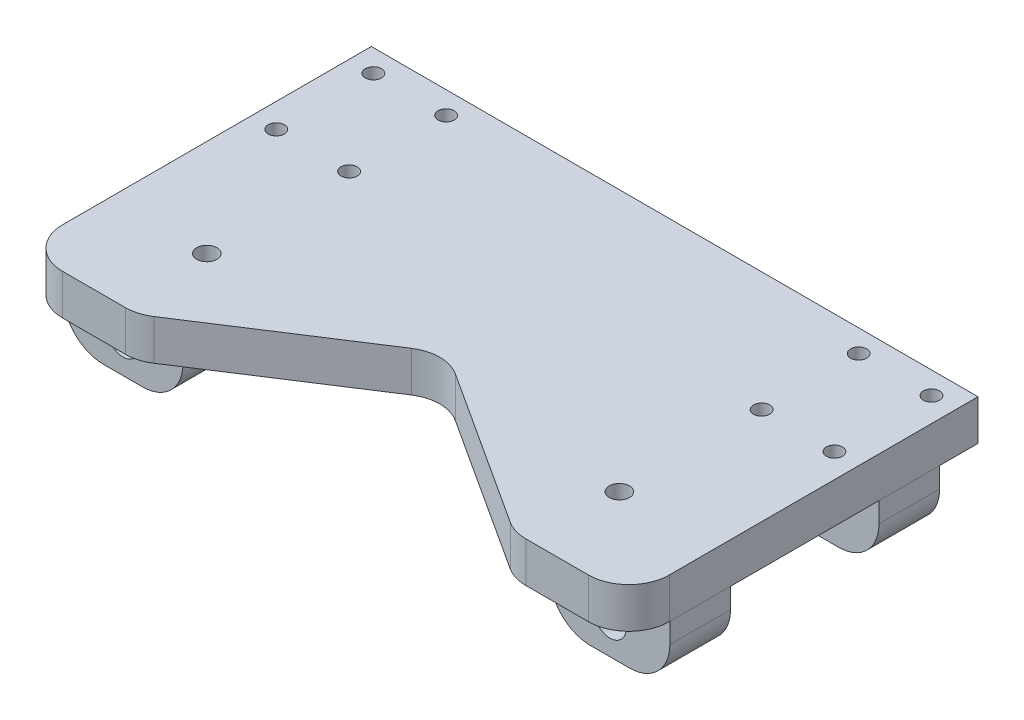
from build123d import *

# Parameters (mm, degrees)
SKETCH3_R               = 2
SKETCH3_R_2             = 2.5
BOSS_EXTRUDE3_DEPTH     = 10
SKETCH4_W               = 29.621982307
SKETCH4_H               = 15
SKETCH4_W_2             = 29.629902686
BOSS_EXTRUDE4_DEPTH     = 15
FILLET1_R               = 10
CUT_EXTRUDE1_DEPTH      = 57
CUT_EXTRUDE1_DEPTH_BACK = 15
SKETCH5_R               = 4
FILLET3_R               = 10


with BuildPart() as part:
    # Sketch3 → Boss-Extrude3 (new body)
    with BuildSketch(Plane(origin=(0, 0, 0), x_dir=(1, 0, 0), z_dir=(0, 1, 0))):
        with BuildLine():
            Line((-74.553080605, -18.028525235), (-74.553080605, 16.971474765))
            Line((-74.553080605, 16.971474765), (75.446919395, 16.971474765))
            Line((75.446919395, 16.971474765), (75.446919395, -18.028525235))
            Line((75.446919395, -18.028525235), (75.446919395, -59.351917417))
            ThreePointArc((75.446919395, -59.351917417), (72.517987207, -66.422985229), (65.446919395, -69.351917417))
            Line((65.446919395, -69.351917417), (49.960719272, -69.351917417))
            ThreePointArc((49.960719272, -69.351917417), (47.125982353, -68.941717551), (44.523807175, -67.744770737))
            Line((44.523807175, -67.744770737), (5.883831491, -42.713694512))
            ThreePointArc((5.883831491, -42.713694512), (0.446919395, -41.106547832), (-4.989992702, -42.713694512))
            Line((-4.989992702, -42.713694512), (-43.629968386, -67.744770737))
            ThreePointArc((-43.629968386, -67.744770737), (-46.232143563, -68.941717551), (-49.066880482, -69.351917417))
            Line((-49.066880482, -69.351917417), (-64.553080605, -69.351917417))
            ThreePointArc((-64.553080605, -69.351917417), (-71.624148417, -66.422985229), (-74.553080605, -59.351917417))
            Line((-74.553080605, -59.351917417), (-74.553080605, -18.028525235))
        make_face()
        with Locations((-68.553080605, 11.471474765)):
            Circle(SKETCH3_R, mode=Mode.SUBTRACT)
        with Locations((-50.553080605, 11.471474765)):
            Circle(SKETCH3_R, mode=Mode.SUBTRACT)
        with Locations((-68.553080605, -12.528525235)):
            Circle(SKETCH3_R, mode=Mode.SUBTRACT)
        with Locations((-50.553080605, -12.528525235)):
            Circle(SKETCH3_R, mode=Mode.SUBTRACT)
        with Locations((51.446919395, -12.528525235)):
            Circle(SKETCH3_R, mode=Mode.SUBTRACT)
        with Locations((69.446919395, -12.528525235)):
            Circle(SKETCH3_R, mode=Mode.SUBTRACT)
        with Locations((69.446919395, 11.471474765)):
            Circle(SKETCH3_R, mode=Mode.SUBTRACT)
        with Locations((51.446919395, 11.471474765)):
            Circle(SKETCH3_R, mode=Mode.SUBTRACT)
        with Locations((-50.553080605, -47.693315976)):
            Circle(SKETCH3_R_2, mode=Mode.SUBTRACT)
        with Locations((51.446919395, -47.693315976)):
            Circle(SKETCH3_R_2, mode=Mode.SUBTRACT)
    extrude(amount=BOSS_EXTRUDE3_DEPTH)

    # Sketch4 → Boss-Extrude4 (add)
    with BuildSketch(Plane.XZ):
        with Locations((-59.742089452, 0)):
            Rectangle(SKETCH4_W, SKETCH4_H)
        with Locations((60.624047673, 0)):
            Rectangle(SKETCH4_W_2, SKETCH4_H)
        with Locations((60.624047673, 51.713197214)):
            Rectangle(SKETCH4_W_2, SKETCH4_H)
        with Locations((-59.742089452, 51.713197214)):
            Rectangle(SKETCH4_W, SKETCH4_H)
    extrude(amount=BOSS_EXTRUDE4_DEPTH)

    # Fillet1
    fillet1_edges = [part.edges().sort_by_distance(p)[0] for p in [
        (75.438999016, -15, 0),
        (45.80909633, -15, 0),
        (-44.931098298, -15, 0),
        (-74.553080605, -15, 0),
    ]]
    fillet(fillet1_edges, radius=FILLET1_R)

    # Sketch5 → Cut-Extrude1 (cut, two sides: drawn at the far end of the back side and taken through both)
    with BuildSketch(Plane.XY.offset(7.5).offset(-CUT_EXTRUDE1_DEPTH_BACK)):
        with Locations((-59.742089451, -7.004049179)):
            Circle(SKETCH5_R)
        with Locations((60.620087484, -7.004049179)):
            Circle(SKETCH5_R)
    extrude(amount=CUT_EXTRUDE1_DEPTH + CUT_EXTRUDE1_DEPTH_BACK, mode=Mode.SUBTRACT)

    # Fillet3
    fillet3_edges = [part.edges().sort_by_distance(p)[0] for p in [
        (75.438999016, -15, 51.713197214),
        (45.80909633, -15, 51.713197214),
        (-44.931098298, -15, 51.713197214),
        (-74.553080605, -15, 51.713197214),
    ]]
    fillet(fillet3_edges, radius=FILLET3_R)


solid = part.part
